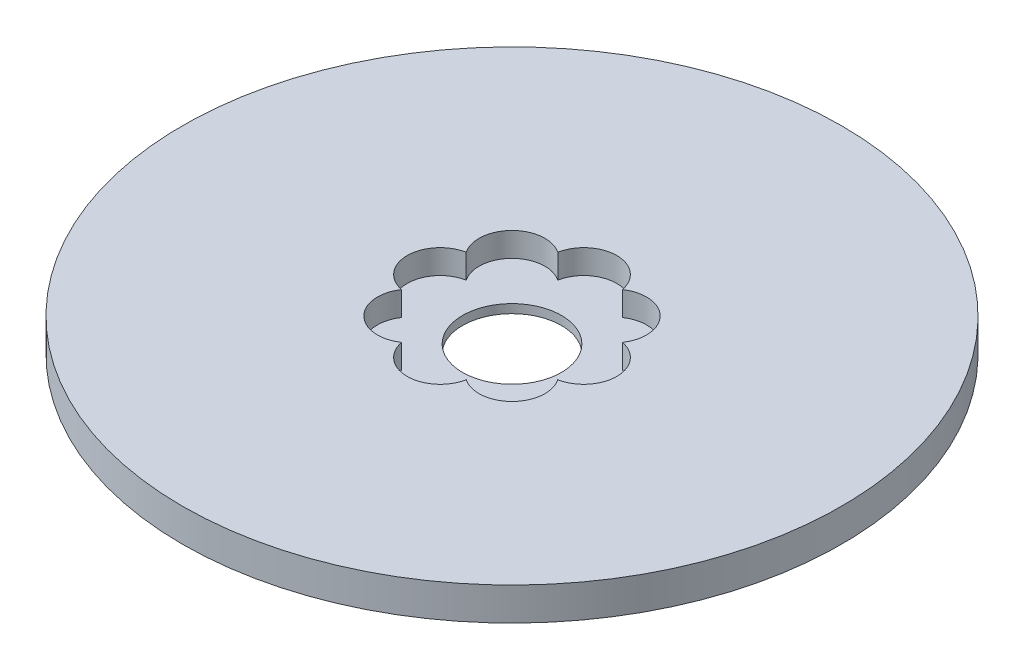
from build123d import *

# Parameters (mm, degrees)
SKETCH1_R           = 100
BOSS_EXTRUDE1_DEPTH = 10
SKETCH2_R           = 15
CUT_EXTRUDE1_DEPTH  = 142.774468788
SKETCH3_R           = 10
CUT_EXTRUDE2_DEPTH  = 7.34269734
CIRPATTERN1_COUNT   = 8


with BuildPart() as part:
    # Sketch1 → Boss-Extrude1 (new body)
    with BuildSketch(Plane(origin=(0, 0, 0), x_dir=(1, 0, 0), z_dir=(0, 1, 0))):
        Circle(SKETCH1_R)
    extrude(amount=BOSS_EXTRUDE1_DEPTH)

    # Sketch2 → Cut-Extrude1 (cut, through all)
    with BuildSketch(Plane(origin=(0, 0, 0), x_dir=(1, 0, 0), z_dir=(0, 1, 0))):
        Circle(SKETCH2_R)
    extrude(amount=CUT_EXTRUDE1_DEPTH, mode=Mode.SUBTRACT)

    # Sketch3 → Cut-Extrude2 (cut)
    with BuildSketch(Plane(origin=(0, 10, 0), x_dir=(1, 0, 0), z_dir=(0, 1, 0))):
        with Locations((-21.793050468, 0)):
            Circle(SKETCH3_R)
    cut_extrude2 = extrude(amount=-CUT_EXTRUDE2_DEPTH, mode=Mode.SUBTRACT)

    # CirPattern1: Cut-Extrude2 ×8 about axis
    cirpattern1_axis = Axis((0, 0, 0), (0, 1, 0))
    for i in range(1, CIRPATTERN1_COUNT):
        add(cut_extrude2.rotate(cirpattern1_axis, i * 360 / CIRPATTERN1_COUNT), mode=Mode.SUBTRACT)


solid = part.part
